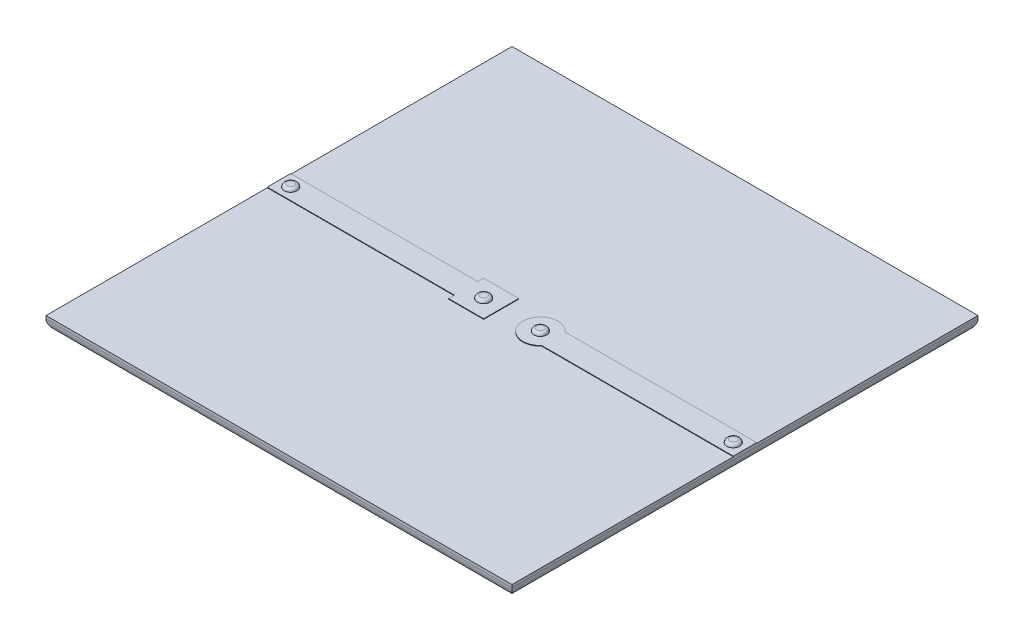
from build123d import *

# Parameters (mm, degrees)
SKETCH_1_W      = 79.7
SKETCH_1_H      = 79.7
EXTRUDE_1_DEPTH = 2.5
FILLET_1_R      = 2
SKETCH_2_W      = 37
SKETCH_2_H      = 4
EXTRUDE_2_DEPTH = 0.1
SKETCH_3_R      = 3
SKETCH_3_W      = 6
SKETCH_3_H      = 6
EXTRUDE_3_DEPTH = 0.1
SKETCH_4_R      = 1.1
EXTRUDE_4_DEPTH = 0.5
FILLET_2_R      = 0.5


with BuildPart() as part:
    # Эскиз1 → Бобышка-Вытянуть1 (new body)
    with BuildSketch(Plane(origin=(0, 0, 0), x_dir=(1, 0, 0), z_dir=(0, 1, 0))):
        Rectangle(SKETCH_1_W, SKETCH_1_H)
    extrude(amount=-EXTRUDE_1_DEPTH)

    # Скругление1
    fillet_1_edges = [part.edges().sort_by_distance(p)[0] for p in [
        (39.85, -2.5, 0),
        (0, -2.5, -39.85),
        (-39.85, -2.5, 0),
        (0, -2.5, 39.85),
    ]]
    fillet(fillet_1_edges, radius=FILLET_1_R)

    # Эскиз2 → Бобышка-Вытянуть2 (add)
    with BuildSketch(Plane(origin=(0, 0, 0), x_dir=(1, 0, 0), z_dir=(0, 1, 0))):
        with Locations((21.35, 0)):
            Rectangle(SKETCH_2_W, SKETCH_2_H)
        with Locations((-21.35, 0)):
            Rectangle(SKETCH_2_W, SKETCH_2_H)
    extrude(amount=EXTRUDE_2_DEPTH)

    # Эскиз3 → Бобышка-Вытянуть3 (add)
    with BuildSketch(Plane(origin=(0, 0, 0), x_dir=(1, 0, 0), z_dir=(0, 1, 0))):
        with Locations((4.85, 0)):
            Circle(SKETCH_3_R)
        with Locations((-4.85, 0)):
            Rectangle(SKETCH_3_W, SKETCH_3_H)
    extrude(amount=EXTRUDE_3_DEPTH)

    # Эскиз4 → Бобышка-Вытянуть4 (add)
    with BuildSketch(Plane(origin=(0, 0.1, 0), x_dir=(1, 0, 0), z_dir=(0, 1, 0))):
        with Locations(Location((4.85, 0, 0), (0, 0, 270))):
            Circle(SKETCH_4_R)
        with Locations(Location((-4.85, 0, 0), (0, 0, 270))):
            Circle(SKETCH_4_R)
        with Locations(Location((37.85, 0, 0), (0, 0, 270))):
            Circle(SKETCH_4_R)
        with Locations(Location((-37.85, 0, 0), (0, 0, 270))):
            Circle(SKETCH_4_R)
    extrude(amount=EXTRUDE_4_DEPTH)

    # Скругление2
    fillet_2_edges = [part.edges().sort_by_distance(p)[0] for p in [
        (4.85, 0.6, -1.1),
        (-4.85, 0.6, -1.1),
        (37.85, 0.6, -1.1),
        (-37.85, 0.6, -1.1),
    ]]
    fillet(fillet_2_edges, radius=FILLET_2_R - 0.0001)  # a hair under: the kernel refuses the full size


solid = part.part
